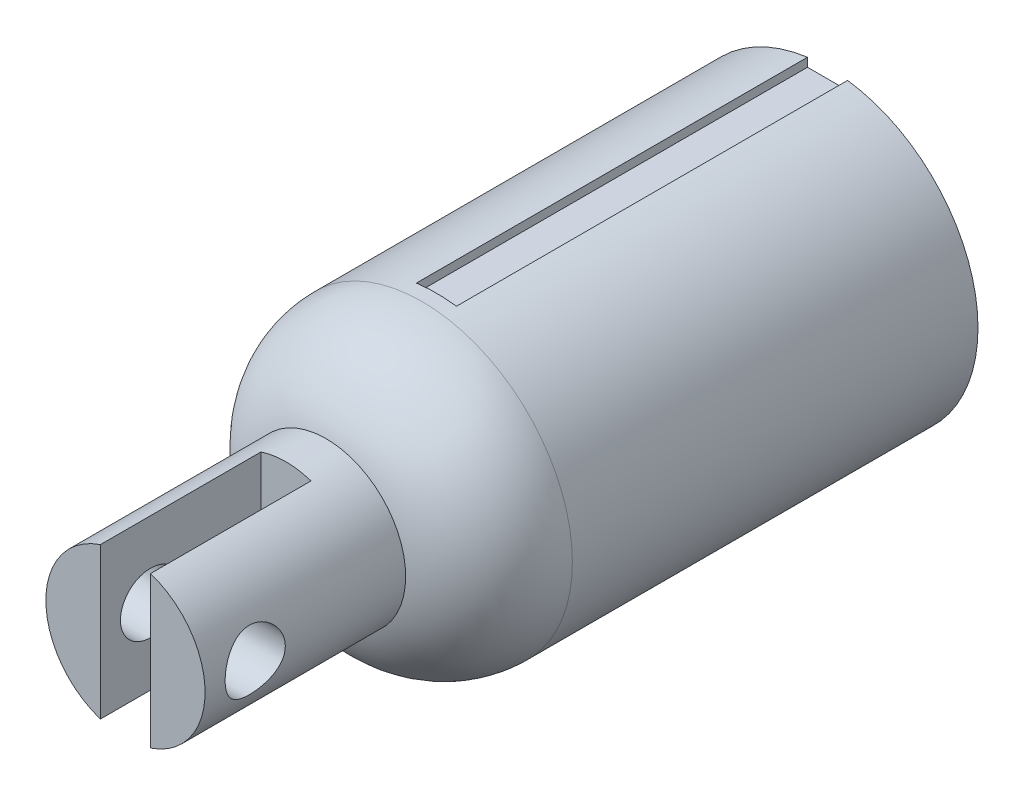
from build123d import *

# Parameters (mm, degrees)
CROQUIS1_R              = 7.9375
SALIENTE_EXTRUIR1_DEPTH = 20
CROQUIS2_R              = 15
SALIENTE_EXTRUIR2_DEPTH = 50
REDONDEO1_R             = 10
CROQUIS3_W              = 5
CROQUIS3_H              = 21.165863944
CORTAR_EXTRUIR1_DEPTH   = 16
CROQUIS4_R              = 3
CORTAR_EXTRUIR2_DEPTH   = 10
CROQUIS5_W              = 4
CROQUIS5_H              = 2
CORTAR_EXTRUIR3_DEPTH   = 39


with BuildPart() as part:
    # Croquis1 → Saliente-Extruir1 (new body)
    with BuildSketch(Plane.XY):
        Circle(CROQUIS1_R)
    extrude(amount=-SALIENTE_EXTRUIR1_DEPTH)

    # Croquis2 → Saliente-Extruir2 (add)
    with BuildSketch(Plane(origin=(0, 0, -20), x_dir=(-1, 0, 0), z_dir=(0, 0, -1))):
        Circle(CROQUIS2_R)
    extrude(amount=SALIENTE_EXTRUIR2_DEPTH)

    # Redondeo1
    # the kernel refuses this fillet: 10 mm, written as the material it takes off along each edge
    with BuildSketch(Plane(origin=(0, 0, -20), x_dir=(-1, 0, 0), z_dir=(0, -1, 0))) as redondeo1_piece_1:
        with BuildLine():
            CenterArc((5, 9.558822822), REDONDEO1_R, 287.082597034, 72.917402966)
            Line((7.9375, 0), (7.99625, -0.191176456))
            ThreePointArc((7.99625, -0.191176456), (11.46875, -0.2), (15, -0.2))
            Line((15, -0.2), (15.2, 0))
            Line((15.2, 0), (15.2, 9.558822822))
            Line((15.2, 9.558822822), (15, 9.558822822))
        make_face()
    revolve(axis=Axis((0, 0, -20), (0, 0, -1)), mode=Mode.SUBTRACT)

    # Croquis3 → Cortar-Extruir1 (cut)
    with BuildSketch(Plane.XY):
        Rectangle(CROQUIS3_W, CROQUIS3_H)
    extrude(amount=-CORTAR_EXTRUIR1_DEPTH, mode=Mode.SUBTRACT)

    # Croquis4 → Cortar-Extruir2 (cut, symmetric)
    with BuildSketch(Plane(origin=(0, 0, 0), x_dir=(0, 0, -1), z_dir=(1, 0, 0))):
        with Locations((5, 0)):
            Circle(CROQUIS4_R)
    extrude(amount=CORTAR_EXTRUIR2_DEPTH, both=True, mode=Mode.SUBTRACT)

    # Croquis5 → Cortar-Extruir3 (cut)
    with BuildSketch(Plane(origin=(0, 0, -70), x_dir=(-1, 0, 0), z_dir=(0, 0, -1))):
        with Locations((0, 15)):
            Rectangle(CROQUIS5_W, CROQUIS5_H)
        with Locations((0, -15)):
            Rectangle(CROQUIS5_W, CROQUIS5_H)
    extrude(amount=-CORTAR_EXTRUIR3_DEPTH, mode=Mode.SUBTRACT)


solid = part.part
